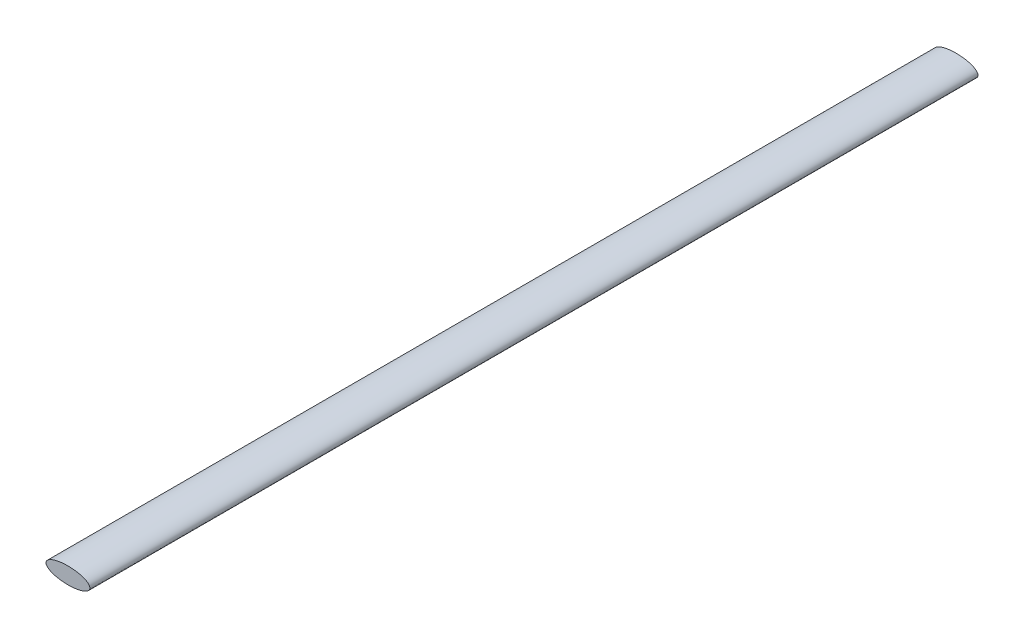
from build123d import *

# Parameters (mm, degrees)
SKETCH1_RX          = 67.7799
SKETCH1_RY          = 25.3619
BOSS_EXTRUDE2_DEPTH = 2743.2


with BuildPart() as part:
    # Sketch1 → Boss-Extrude2 (new body)
    with BuildSketch(Plane.XY):
        with Locations((0, 0)):
            Ellipse(SKETCH1_RX, SKETCH1_RY)
    extrude(amount=BOSS_EXTRUDE2_DEPTH)


solid = part.part
